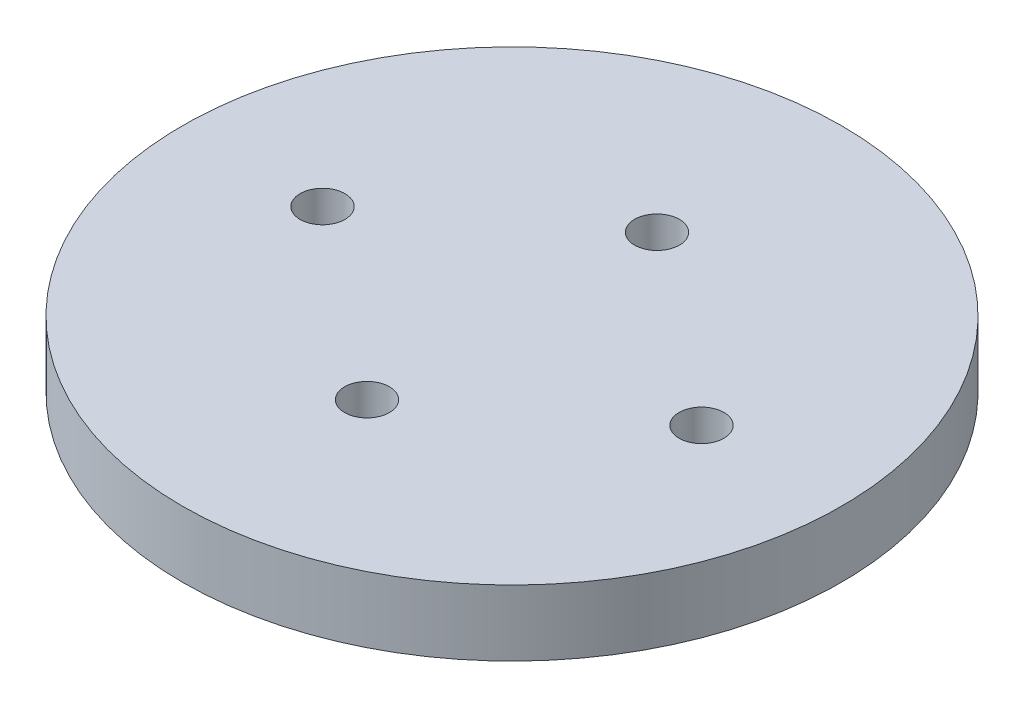
from build123d import *

# Parameters (mm, degrees)
SKETCH1_R           = 25
SKETCH1_R_2         = 1.7
BOSS_EXTRUDE1_DEPTH = 5


with BuildPart() as part:
    # Sketch1 → Boss-Extrude1 (new body)
    with BuildSketch(Plane(origin=(0, 0, 0), x_dir=(1, 0, 0), z_dir=(0, 1, 0))):
        Circle(SKETCH1_R)
        with Locations((-14.375, 0)):
            Circle(SKETCH1_R_2, mode=Mode.SUBTRACT)
        with Locations((0, -11)):
            Circle(SKETCH1_R_2, mode=Mode.SUBTRACT)
        with Locations((14.375, 0)):
            Circle(SKETCH1_R_2, mode=Mode.SUBTRACT)
        with Locations((0, 11)):
            Circle(SKETCH1_R_2, mode=Mode.SUBTRACT)
    extrude(amount=BOSS_EXTRUDE1_DEPTH)


solid = part.part
